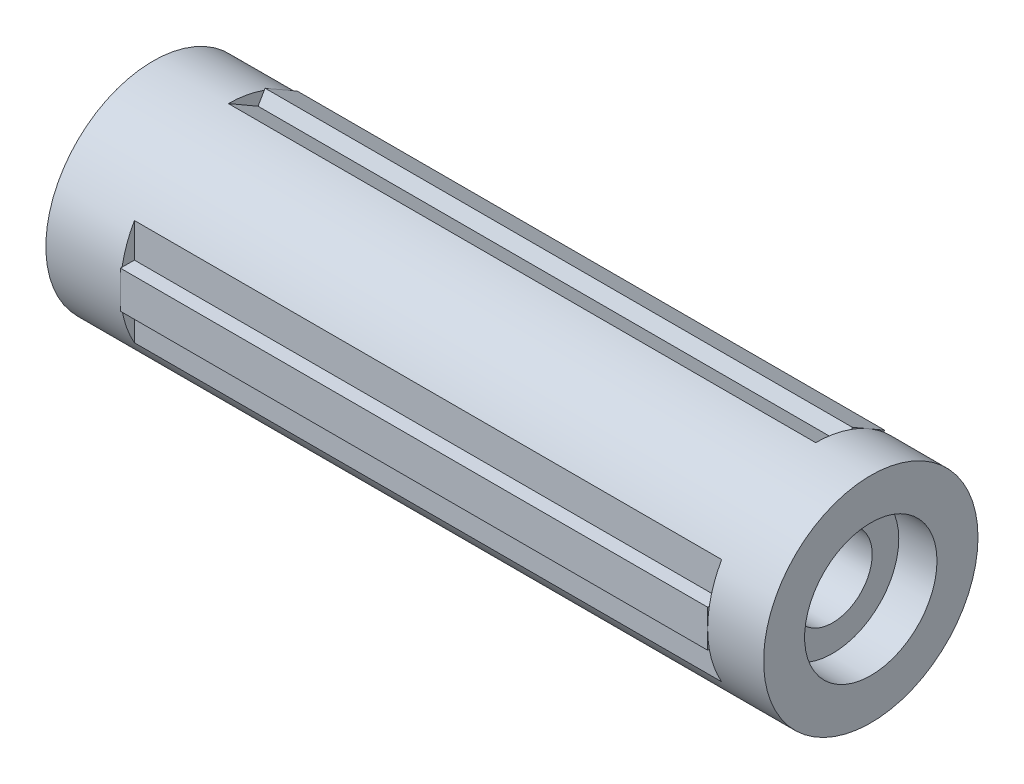
from build123d import *

# Parameters (mm, degrees)
SKIZZE1_R                       = 11.5
AUFSATZ_LINEAR_AUSTRAGEN1_DEPTH = 77
SKIZZE2_R                       = 7.1
SCHNITT_LINEAR_AUSTRAGEN1_DEPTH = 4.1
SKIZZE3_R                       = 4.25
SCHNITT_LINEAR_AUSTRAGEN2_DEPTH = 43
SKIZZE4_R                       = 9.6
SCHNITT_LINEAR_AUSTRAGEN3_DEPTH = 12.75
SCHNITT_LINEAR_START            = -6
SKIZZE7_W                       = 1.5
SKIZZE7_H                       = 15
SCHNITT_LINEAR_AUSTRAGEN4_DEPTH = 63
SKIZZE8_W                       = 63
SKIZZE8_H                       = 4
AUFSATZ_LINEAR_AUSTRAGEN2_DEPTH = 1.5
SCHNITT_LINEAR_AUSTRAGEN6_DEPTH = 13.5
SKIZZE12_R                      = 3
SCHNITT_LINEAR_AUSTRAGEN7_DEPTH = 2
KREISMUSTER3_COUNT              = 3


with BuildPart() as part:
    # Skizze1 → Aufsatz-Linear austragen1 (new body)
    with BuildSketch(Plane(origin=(0, 0, 0), x_dir=(0, 0, -1), z_dir=(1, 0, 0))):
        Circle(SKIZZE1_R)
    extrude(amount=AUFSATZ_LINEAR_AUSTRAGEN1_DEPTH)

    # Skizze2 → Schnitt-Linear austragen1 (cut)
    with BuildSketch(Plane(origin=(77, 0, 0), x_dir=(0, 0, -1), z_dir=(1, 0, 0))):
        Circle(SKIZZE2_R)
    extrude(amount=-SCHNITT_LINEAR_AUSTRAGEN1_DEPTH, mode=Mode.SUBTRACT)

    # Skizze3 → Schnitt-Linear austragen2 (cut)
    with BuildSketch(Plane(origin=(72.9, 0, 0), x_dir=(0, 0, -1), z_dir=(1, 0, 0))):
        Circle(SKIZZE3_R)
    extrude(amount=-SCHNITT_LINEAR_AUSTRAGEN2_DEPTH, mode=Mode.SUBTRACT)

    # Skizze4 → Schnitt-Linear austragen3 (cut)
    with BuildSketch(Plane.ZY):
        Circle(SKIZZE4_R)
    extrude(amount=-SCHNITT_LINEAR_AUSTRAGEN3_DEPTH, mode=Mode.SUBTRACT)

    # Skizze7 → Schnitt-Linear austragen4 (cut)
    with BuildSketch(Plane(origin=(77, 0, 0), x_dir=(0, 0, -1), z_dir=(1, 0, 0)).offset(SCHNITT_LINEAR_START)):
        with Locations((-10.75, 0)):
            Rectangle(SKIZZE7_W, SKIZZE7_H)
    schnitt_linear_austragen4 = extrude(amount=-SCHNITT_LINEAR_AUSTRAGEN4_DEPTH, mode=Mode.SUBTRACT)

    # Skizze8 → Aufsatz-Linear austragen2 (add)
    with BuildSketch(Plane.XY.offset(10)):
        with Locations((39.5, 0)):
            Rectangle(SKIZZE8_W, SKIZZE8_H)
    aufsatz_linear_austragen2 = extrude(amount=AUFSATZ_LINEAR_AUSTRAGEN2_DEPTH)

    # Skizze10 → Schnitt-Linear austragen6 (cut)
    with BuildSketch(Plane.ZY.offset(-12.75)):
        Polygon((4.038863706, -2.240739453), (3.959969143, 2.377388845), (-0.078894563, 4.618128298), (-4.038863706, 2.240739453), (-3.959969143, -2.377388845), (0.078894563, -4.618128298), align=None)
    extrude(amount=-SCHNITT_LINEAR_AUSTRAGEN6_DEPTH, mode=Mode.SUBTRACT)

    # Skizze12 → Schnitt-Linear austragen7 (cut)
    with BuildSketch(Plane.ZY.offset(-26.25)):
        Circle(SKIZZE12_R)
    extrude(amount=-SCHNITT_LINEAR_AUSTRAGEN7_DEPTH, mode=Mode.SUBTRACT)

    # Kreismuster3: Schnitt-Linear austragen4, Aufsatz-Linear austragen2 ×3 about axis
    kreismuster3_axis = Axis((77, 0, 0), (-1, 0, 0))
    add([schnitt_linear_austragen4.rotate(kreismuster3_axis, i * 360 / KREISMUSTER3_COUNT) for i in range(1, KREISMUSTER3_COUNT)], mode=Mode.SUBTRACT)
    add([aufsatz_linear_austragen2.rotate(kreismuster3_axis, i * 360 / KREISMUSTER3_COUNT) for i in range(1, KREISMUSTER3_COUNT)])


solid = part.part
